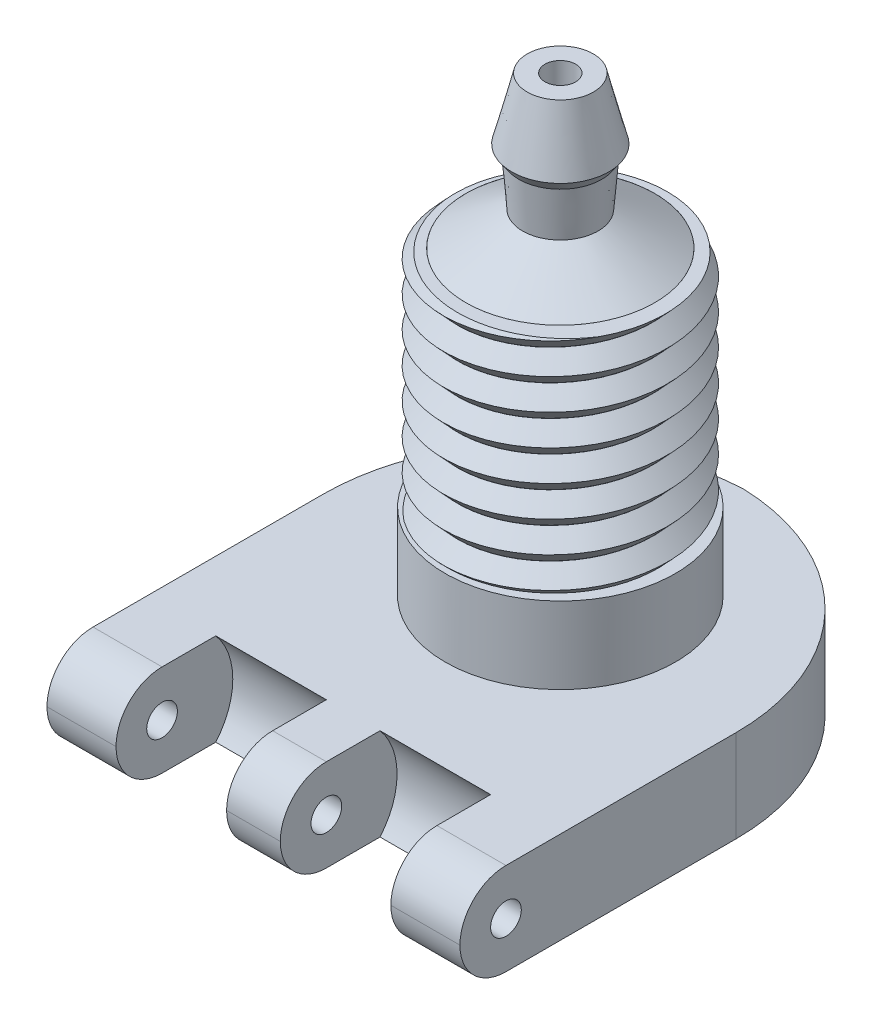
from build123d import *

# Parameters (mm, degrees)
BOSS_EXTRUDE1_DEPTH      = 20
BOSS_EXTRUDE1_DEPTH_BACK = 12
SKETCH2_W                = 26.91519165
SKETCH2_H                = 6
FILLET1_R                = 14
SKETCH4_W                = 7.207595825
SKETCH4_H                = 6.5
CUT_EXTRUDE1_DEPTH       = 13
SKETCH5_R                = 1
CUT_EXTRUDE2_DEPTH       = 30
CUT_EXTRUDE3_DEPTH       = 7.207595825
CUT_EXTRUDE4_START       = 7.207595825
CUT_EXTRUDE4_DEPTH       = 7.207595825
FILLET2_R                = 3
SKETCH8_R                = 1
CUT_EXTRUDE5_DEPTH       = 38
SWEEP3_PITCH             = 2.01214
WRAP1_START              = -0.5
WRAP1_DEPTH              = 0.5


with BuildPart() as part:
    # Sketch1 → Revolve2 (revolve)
    with BuildSketch(Plane.XY):
        Polygon((13.457595825, 35.5), (11.302582741, 35.503288463), (10.291628838, 31.503910259), (10.750306129, 30.852541164), (10.998346612, 27.8087122), (7.098749399, 25.500055313), (7.098749399, 11), (5.953514099, 11), (5.953514099, 6), (13.457595825, 6), align=None)
    revolve(axis=Axis((13.457595825, 35.5, 0), (0, -1, 0)))

    # Sketch2 → Boss-Extrude1 (add, two sides: drawn at the far end of the back side and taken through both)
    with BuildSketch(Plane.XY.offset(-BOSS_EXTRUDE1_DEPTH_BACK)):
        with Locations((13.457595825, 3)):
            Rectangle(SKETCH2_W, SKETCH2_H)
    extrude(amount=BOSS_EXTRUDE1_DEPTH + BOSS_EXTRUDE1_DEPTH_BACK)

    # Fillet1
    # the kernel refuses this fillet: 14 mm, written as the material it takes off along each edge
    with BuildSketch(Plane(origin=(0, 41, -12), x_dir=(0, 0, 1), z_dir=(0, -1, 0)), Plane(origin=(26.91519165, -35, -12), x_dir=(0, 0, 1), z_dir=(0, 1, 0))) as fillet1_piece_1:
        with BuildLine():
            CenterArc((FILLET1_R, -FILLET1_R), FILLET1_R, 90, 90)
            Line((0, -FILLET1_R), (0, 0))
            Line((0, 0), (FILLET1_R, 0))
        make_face()
    extrude(amount=76, mode=Mode.SUBTRACT)

    # Sketch4 → Cut-Extrude1 (cut)
    with BuildSketch(Plane.XZ):
        with Locations((18.811393738, 16.75)):
            Rectangle(SKETCH4_W, SKETCH4_H)
        with Locations((8.103797912, 16.75)):
            Rectangle(SKETCH4_W, SKETCH4_H)
    extrude(amount=-CUT_EXTRUDE1_DEPTH, mode=Mode.SUBTRACT)

    # Sketch5 → Cut-Extrude2 (cut)
    with BuildSketch(Plane.ZY):
        with Locations((17, 3)):
            Circle(SKETCH5_R)
    extrude(amount=-CUT_EXTRUDE2_DEPTH, mode=Mode.SUBTRACT)

    # Sketch6 → Cut-Extrude3 (cut)
    with BuildSketch(Plane.ZY.offset(-11.707595825)):
        with BuildLine():
            Line((13.5, 6), (13.5, 0))
            ThreePointArc((13.5, 0), (12.390227771, 3), (13.5, 6))
        make_face()
    extrude(amount=CUT_EXTRUDE3_DEPTH, mode=Mode.SUBTRACT)

    # Sketch7 → Cut-Extrude4 (cut)
    with BuildSketch(Plane(origin=(15.207595825, 0, 0), x_dir=(0, 0, -1), z_dir=(1, 0, 0)).offset(CUT_EXTRUDE4_START)):
        with BuildLine():
            Line((-13.5, 0), (-13.5, 6))
            ThreePointArc((-13.5, 6), (-12.390227771, 3), (-13.5, 0))
        make_face()
    extrude(amount=-CUT_EXTRUDE4_DEPTH, mode=Mode.SUBTRACT)

    # Fillet2
    fillet2_edges = [part.edges().sort_by_distance(p)[0] for p in [
        (24.66519165, 0, 20),
        (24.66519165, 6, 20),
        (13.457595825, 6, 20),
        (2.25, 0, 20),
        (2.25, 6, 20),
        (13.457595825, 0, 20),
    ]]
    fillet(fillet2_edges, radius=FILLET2_R - 0.0001)  # a hair under: the kernel refuses the full size

    # Sketch8 → Cut-Extrude5 (cut)
    with BuildSketch(Plane.XZ):
        with Locations(Location((13.457595825, 0, 0), (0, 0, 270))):
            Circle(SKETCH8_R)
    extrude(amount=-CUT_EXTRUDE5_DEPTH, mode=Mode.SUBTRACT)

    # Sweep3: arcs per turn and ends read off the stored shape
    # Sweep3: the profile of Sketch9 screwed along a right-hand helix through 8 turns, 10 arcs to a turn; built about Z, then put on its axis
    sweep3_z = Axis((0, 0, 0), (0, 0, 1))
    sweep3_corners = [(6.358846426, 0, 0.701156501), (7.292926426, 0, -0.300558499), (6.358846426, 0, -1.302273499), (6.161908614, 0, -1.302273499), (6.161908614, 0, 0.701156501)]
    with BuildLine(mode=Mode.PRIVATE) as sweep3_profile:
        Line(sweep3_corners[0], sweep3_corners[1])
        Line(sweep3_corners[1], sweep3_corners[2])
        Line(sweep3_corners[2], sweep3_corners[3])
        Line(sweep3_corners[3], sweep3_corners[4])
        Line(sweep3_corners[4], sweep3_corners[0])
    sweep3_cap = Face(sweep3_profile.wire())
    sweep3_turn_angles = [0, 18, 36, 54, 72, 90, 108, 126, 144, 162, 180, 198, 216, 234, 252, 270, 288, 306, 324, 342, 360]
    sweep3_turn_weights = [1, 0.9510565162951535, 1, 0.9510565162951535, 1, 0.9510565162951535, 1, 0.9510565162951535, 1, 0.9510565162951535, 1, 0.9510565162951535, 1, 0.9510565162951535, 1, 0.9510565162951535, 1, 0.9510565162951535, 1, 0.9510565162951535, 1]
    sweep3_turn_rails = [Edge.make_bspline([Vector(p[0], p[1], 0).rotate(sweep3_z, sweep3_turn_angles[k]) / sweep3_turn_weights[k] + Vector(0, 0, p[2] + SWEEP3_PITCH * sweep3_turn_angles[k] / 360) for k in range(21)], [0, 0, 0, 1, 1, 2, 2, 3, 3, 4, 4, 5, 5, 6, 6, 7, 7, 8, 8, 9, 9, 10, 10, 10], 2, sweep3_turn_weights) for p in sweep3_corners]
    sweep3_turn_sides = [Face.make_surface_from_curves(sweep3_turn_rails[p[0]], sweep3_turn_rails[p[1]]) for p in [(0, 1), (1, 2), (2, 3), (3, 4), (4, 0)]]
    sweep3 = Plane(origin=(13.457595825, 11, 0), x_dir=(-1, 0, 0), z_dir=(0, 1, 0)) * Solid(Shell([*[p.moved(Location((0, 0, SWEEP3_PITCH * i))) for i in range(8) for p in sweep3_turn_sides], sweep3_cap, sweep3_cap.rotate(sweep3_z, 2880).moved(Location((0, 0, SWEEP3_PITCH * 2880 / 360)))]))
    add(sweep3)

    # Sketch17 → Cut-Revolve1 (revolve, cut)
    with BuildSketch(Plane.XY, mode=Mode.PRIVATE) as cut_revolve1_sk:
        Polygon((10.998346612, 27.8087122), (7.299797899, 25.61908094), (3.175246287, 25.61908094), (3.175246287, 28.971235863), align=None)
    revolve(cut_revolve1_sk.sketch.rotate(Axis((13.457595825, 30.852541164, 0), (0, 1, 0)), 307.237240979), axis=Axis((13.457595825, 30.852541164, 0), (0, 1, 0)), mode=Mode.SUBTRACT)

    # Wrap1: read off the stored shape, not the designer's step
    # Wrap1 outline → Wrap1 (cut)
    # profile 1 of 3: a face of its own
    with BuildSketch(Plane(origin=(0, 0, 0), x_dir=(-1, 0, 0), z_dir=(0, -1, 0)).offset(WRAP1_START)):
        with BuildLine():
            add(Edge.make_bspline(
                [(-9.153677489, -6.033817377), (-9.091342639, -6.034096401), (-8.971085647, -6.034634697), (-8.797665171, -6.041162251), (-8.63767629, -6.052860025), (-8.491155762, -6.067316623), (-8.358163833, -6.087584212), (-8.238533957, -6.110819416), (-8.132241307, -6.139126656), (-8.038087277, -6.172726958), (-7.953587076, -6.212340402), (-7.873622632, -6.254531546), (-7.80000115, -6.30488519), (-7.729006732, -6.35797443), (-7.664698251, -6.418870861), (-7.603063759, -6.483521738), (-7.546713645, -6.554491061), (-7.495386803, -6.630919765), (-7.448825449, -6.711395775), (-7.408146335, -6.796062959), (-7.375149715, -6.885055292), (-7.347469655, -6.977797097), (-7.32523676, -7.07428433), (-7.310437838, -7.175110397), (-7.300385666, -7.279571293), (-7.2994987, -7.350667444), (-7.299050086, -7.386626872)],
                knots=[0, 0, 0, 0, 0.070781161, 0.136551696, 0.197012482, 0.252922694, 0.303686532, 0.349719151, 0.391240471, 0.428478555, 0.463056565, 0.497150358, 0.531002334, 0.564226377, 0.59770067, 0.631421421, 0.665597347, 0.700451436, 0.735880684, 0.771092108, 0.806974845, 0.843534403, 0.880940196, 0.919294384, 0.95918024, 1, 1, 1, 1], degree=3))
            Line((-9.153677489, -6.033817377), (-10.107703932, -6.033817377))
            Line((-10.107703932, -6.033817377), (-10.107703932, -10.796317377))
            Line((-10.107703932, -10.796317377), (-9.252896239, -10.796317377))
            Line((-9.252896239, -10.796317377), (-9.252896239, -8.720355839))
            add(Edge.make_bspline(
                [(-8.282651348, -8.647849829), (-8.307065584, -8.653924131), (-8.359954682, -8.667083024), (-8.447471611, -8.680442603), (-8.548325684, -8.692725915), (-8.662843027, -8.703281934), (-8.791089663, -8.710457568), (-8.932941414, -8.716061418), (-9.088462566, -8.720135996), (-9.196605825, -8.72028058), (-9.252896239, -8.720355839)],
                knots=[0, 0, 0, 0, 0.077372749, 0.167614291, 0.272108317, 0.390015992, 0.52136331, 0.667272254, 0.826809521, 1, 1, 1, 1], degree=3))
            add(Edge.make_bspline(
                [(-7.299050086, -7.386626872), (-7.299699175, -7.426407932), (-7.300974715, -7.504582602), (-7.313479116, -7.619177078), (-7.334840584, -7.728432535), (-7.362758906, -7.833270345), (-7.40168902, -7.931965693), (-7.446164847, -8.026873481), (-7.500884222, -8.115332785), (-7.563409856, -8.198450124), (-7.631694981, -8.276901283), (-7.707360683, -8.348421131), (-7.788964742, -8.413497218), (-7.876034782, -8.472811546), (-7.968897688, -8.526244464), (-8.067486455, -8.574296316), (-8.172474305, -8.615430254), (-8.245584685, -8.63694297), (-8.282651348, -8.647849829)],
                knots=[0, 0, 0, 0, 0.068875425, 0.135348675, 0.199289315, 0.26155008, 0.322915384, 0.382771997, 0.442843572, 0.502652029, 0.562748843, 0.622739582, 0.682687332, 0.743329247, 0.805012514, 0.86806712, 0.933110571, 1, 1, 1, 1], degree=3))
        make_face()
        with BuildLine():
            add(Edge.make_bspline(
                [(-8.950469857, -7.865548146), (-8.895438602, -7.865199205), (-8.794180276, -7.864557149), (-8.655897159, -7.855272641), (-8.544770187, -7.841093321), (-8.456977815, -7.820756897), (-8.387657422, -7.789893681), (-8.327872924, -7.754190752), (-8.276594233, -7.709045378), (-8.232194434, -7.657459064), (-8.196698132, -7.598183803), (-8.172083296, -7.532184779), (-8.156093983, -7.460848701), (-8.154617221, -7.411203512), (-8.153857778, -7.385672846)],
                knots=[0, 0, 0, 0, 0.155159592, 0.285495954, 0.390502806, 0.470975045, 0.538445527, 0.60365534, 0.666587169, 0.73019895, 0.794944675, 0.860228437, 0.928120706, 1, 1, 1, 1], degree=3))
            Line((-8.950469857, -7.865548146), (-9.252896239, -7.865548146))
            Line((-9.252896239, -7.865548146), (-9.252896239, -6.888625069))
            Line((-9.252896239, -6.888625069), (-8.983860783, -6.888625069))
            add(Edge.make_bspline(
                [(-8.378053992, -6.983073687), (-8.393172607, -6.97542777), (-8.425181814, -6.959239796), (-8.479696597, -6.940420093), (-8.542605824, -6.9245436), (-8.614334203, -6.911366264), (-8.69459559, -6.901139283), (-8.783375663, -6.893318201), (-8.880805072, -6.890173039), (-8.948561397, -6.889155291), (-8.983860783, -6.888625069)],
                knots=[0, 0, 0, 0, 0.08210116, 0.173824981, 0.278953094, 0.396639095, 0.527315592, 0.671298143, 0.82875438, 1, 1, 1, 1], degree=3))
            add(Edge.make_bspline(
                [(-8.153857778, -7.385672846), (-8.154609409, -7.363367035), (-8.156067755, -7.3200884), (-8.166781159, -7.257626595), (-8.183855244, -7.199399307), (-8.208594937, -7.146014643), (-8.240577501, -7.097563313), (-8.279570719, -7.054064403), (-8.325074231, -7.014586347), (-8.360205603, -6.993690009), (-8.378053992, -6.983073687)],
                knots=[0, 0, 0, 0, 0.137787685, 0.267341238, 0.390444331, 0.511777883, 0.629508981, 0.747829066, 0.87188531, 1, 1, 1, 1], degree=3))
        make_face(mode=Mode.SUBTRACT)
    # profile 2 of 3: a face of its own
    with BuildSketch(Plane(origin=(0, 0, 0), x_dir=(-1, 0, 0), z_dir=(0, -1, 0)).offset(WRAP1_START)):
        with BuildLine():
            add(Edge.make_bspline(
                [(-13.670992694, -6.033817377), (-13.587020683, -6.03440437), (-13.424701837, -6.035539034), (-13.189533942, -6.048323972), (-12.970857725, -6.067986299), (-12.768532223, -6.095035393), (-12.582972236, -6.130828751), (-12.414417041, -6.175724503), (-12.262300925, -6.22754918), (-12.124955967, -6.288531429), (-11.999573231, -6.359630675), (-11.880518321, -6.438829527), (-11.768024999, -6.529029271), (-11.6605146, -6.628489773), (-11.559374567, -6.739030632), (-11.462920557, -6.858820893), (-11.373514202, -6.989597678), (-11.288452941, -7.128225373), (-11.211526349, -7.275291469), (-11.144428101, -7.429544169), (-11.088219492, -7.589990801), (-11.042547086, -7.756802359), (-11.006140907, -7.929425078), (-10.980668238, -8.108207296), (-10.96492078, -8.29298349), (-10.963323332, -8.418215389), (-10.962511624, -8.481849228)],
                knots=[0, 0, 0, 0, 0.060148162, 0.116267077, 0.168653955, 0.217398969, 0.262433523, 0.303932701, 0.342259967, 0.377441339, 0.411406099, 0.445398351, 0.479766387, 0.514584482, 0.550213651, 0.587000908, 0.624662987, 0.663615456, 0.703456428, 0.743450162, 0.784013386, 0.825132536, 0.867264663, 0.910306473, 0.954424205, 1, 1, 1, 1], degree=3))
            Line((-13.670992694, -6.033817377), (-14.748088547, -6.033817377))
            Line((-14.748088547, -6.033817377), (-14.748088547, -10.796317377))
            Line((-14.748088547, -10.796317377), (-13.654774244, -10.796317377))
            add(Edge.make_bspline(
                [(-10.962511624, -8.481849228), (-10.964637114, -8.571640717), (-10.968821265, -8.748400518), (-11.00406622, -9.007793489), (-11.061069244, -9.256447524), (-11.141220674, -9.492417554), (-11.240586992, -9.713602231), (-11.359291185, -9.916101055), (-11.495592774, -10.098827117), (-11.647903837, -10.260870589), (-11.812819622, -10.400149149), (-11.984200379, -10.519431044), (-12.163715669, -10.613494771), (-12.321893726, -10.673145241), (-12.459053836, -10.710242672), (-12.579478928, -10.732167611), (-12.716269546, -10.752274102), (-12.870701143, -10.767811966), (-13.04209626, -10.781667923), (-13.231138082, -10.78919671), (-13.437214544, -10.795452015), (-13.580354132, -10.796021365), (-13.654774244, -10.796317377)],
                knots=[0, 0, 0, 0, 0.065772947, 0.129477895, 0.191430088, 0.252445668, 0.311786958, 0.36881755, 0.424091518, 0.478492106, 0.531393744, 0.58200397, 0.631201271, 0.679503008, 0.705561374, 0.735221723, 0.769132486, 0.80685832, 0.848929771, 0.895116661, 0.945469804, 1, 1, 1, 1], degree=3))
        make_face()
        with BuildLine():
            add(Edge.make_bspline(
                [(-13.44679648, -9.941509685), (-13.393671696, -9.941412338), (-13.291495052, -9.941225108), (-13.143975106, -9.932307186), (-13.007556561, -9.923356051), (-12.882614945, -9.906366498), (-12.768240972, -9.887441331), (-12.666005841, -9.861104369), (-12.573802041, -9.833439623), (-12.492755824, -9.798218971), (-12.418524093, -9.758575784), (-12.349793989, -9.712129195), (-12.283450196, -9.660552009), (-12.220733064, -9.602327268), (-12.161405224, -9.538225977), (-12.105817698, -9.46791785), (-12.053228538, -9.391617401), (-12.00498761, -9.308921209), (-11.960904791, -9.220702564), (-11.921798391, -9.127815994), (-11.889373415, -9.029487952), (-11.86242376, -8.926638908), (-11.843165175, -8.818373444), (-11.82723237, -8.705493468), (-11.819018545, -8.587551757), (-11.817891248, -8.507300276), (-11.817319316, -8.466584805)],
                knots=[0, 0, 0, 0, 0.062614648, 0.120428813, 0.174199486, 0.223724664, 0.26902845, 0.310765001, 0.348115258, 0.382378114, 0.414753161, 0.447195432, 0.480044579, 0.513738641, 0.547962504, 0.582917814, 0.619315101, 0.657123545, 0.695686576, 0.735513716, 0.7758232, 0.817652262, 0.860742584, 0.905386927, 0.951998197, 1, 1, 1, 1], degree=3))
            Line((-13.44679648, -9.941509685), (-13.893280855, -9.941509685))
            Line((-13.893280855, -9.941509685), (-13.893280855, -6.888625069))
            Line((-13.893280855, -6.888625069), (-13.567003812, -6.888625069))
            add(Edge.make_bspline(
                [(-12.266665771, -7.270235646), (-12.302088149, -7.239232492), (-12.374434346, -7.17591206), (-12.501450494, -7.100037989), (-12.641415711, -7.033375181), (-12.797531981, -6.980519008), (-12.96829051, -6.938718094), (-13.154708339, -6.909889025), (-13.35578716, -6.891363771), (-13.495089883, -6.889557528), (-13.567003812, -6.888625069)],
                knots=[0, 0, 0, 0, 0.101663476, 0.207636138, 0.318744567, 0.436679942, 0.563506646, 0.698681208, 0.844446556, 1, 1, 1, 1], degree=3))
            add(Edge.make_bspline(
                [(-11.817319316, -8.466584805), (-11.818458411, -8.404192195), (-11.820679557, -8.28253144), (-11.842099811, -8.105329894), (-11.876967899, -7.938468093), (-11.926721301, -7.782565306), (-11.989437006, -7.637183362), (-12.06794033, -7.503553957), (-12.158852792, -7.379432299), (-12.230743887, -7.306618552), (-12.266665771, -7.270235646)],
                knots=[0, 0, 0, 0, 0.142276686, 0.277428514, 0.406477152, 0.530595072, 0.650142922, 0.766850697, 0.883502093, 1, 1, 1, 1], degree=3))
        make_face(mode=Mode.SUBTRACT)
    # profile 3 of 3: a face of its own
    with BuildSketch(Plane(origin=(0, 0, 0), x_dir=(-1, 0, 0), z_dir=(0, -1, 0)).offset(WRAP1_START)):
        with BuildLine():
            add(Edge.make_bspline(
                [(-18.53366547, -7.193913531), (-18.527630203, -7.151184744), (-18.515798461, -7.067417787), (-18.487486685, -6.946144102), (-18.453622745, -6.831107711), (-18.411345347, -6.722672912), (-18.361760837, -6.620646547), (-18.305373434, -6.524678511), (-18.241573569, -6.435180717), (-18.192670297, -6.38126689), (-18.168273343, -6.354370262)],
                knots=[0, 0, 0, 0, 0.138934236, 0.272371367, 0.40070198, 0.524915333, 0.646775011, 0.765706493, 0.883115226, 1, 1, 1, 1], degree=3))
            Line((-18.53366547, -7.193913531), (-17.678857778, -7.193913531))
            add(Edge.make_bspline(
                [(-17.121706336, -6.766509685), (-17.152678512, -6.768034198), (-17.214136795, -6.7710593), (-17.304007201, -6.793637855), (-17.389354145, -6.831646043), (-17.468410333, -6.884057094), (-17.540034573, -6.947000545), (-17.598817408, -7.021543997), (-17.647710184, -7.103221424), (-17.668434544, -7.163564316), (-17.678857778, -7.193913531)],
                knots=[0, 0, 0, 0, 0.123522589, 0.245106649, 0.36726561, 0.494690546, 0.622323873, 0.746002836, 0.872253148, 1, 1, 1, 1], degree=3))
            add(Edge.make_bspline(
                [(-16.640877009, -7.214902113), (-16.642533199, -7.183896003), (-16.645765731, -7.123378641), (-16.670871327, -7.036765547), (-16.714451798, -6.959557153), (-16.772885558, -6.891915927), (-16.844089125, -6.835416905), (-16.927552189, -6.794399579), (-17.021463594, -6.770300068), (-17.087535328, -6.76780176), (-17.121706336, -6.766509685)],
                knots=[0, 0, 0, 0, 0.126208081, 0.246331455, 0.363483818, 0.484754462, 0.608382757, 0.731214254, 0.860989275, 1, 1, 1, 1], degree=3))
            add(Edge.make_bspline(
                [(-17.556742393, -7.804490454), (-17.50007993, -7.799664897), (-17.394075681, -7.790637236), (-17.246936101, -7.769525737), (-17.123063541, -7.741306743), (-17.019480723, -7.707262054), (-16.933472188, -7.663539803), (-16.858335607, -7.61527237), (-16.793624429, -7.559216799), (-16.738934803, -7.497044662), (-16.695184804, -7.430277617), (-16.664221103, -7.359953421), (-16.643774293, -7.288247992), (-16.641836959, -7.23920364), (-16.640877009, -7.214902113)],
                knots=[0, 0, 0, 0, 0.141703761, 0.265099674, 0.370057991, 0.458023549, 0.535993518, 0.609847615, 0.680075159, 0.748587094, 0.815630364, 0.878070744, 0.939583928, 1, 1, 1, 1], degree=3))
            Line((-17.556742393, -7.804490454), (-17.556742393, -8.598240454))
            add(Edge.make_bspline(
                [(-16.396646239, -9.368139793), (-16.397551757, -9.341997468), (-16.399354434, -9.28995409), (-16.414082494, -9.214007722), (-16.437341215, -9.140953438), (-16.469650419, -9.071114755), (-16.512795759, -9.004749085), (-16.56370678, -8.940524932), (-16.626394428, -8.881785048), (-16.695171172, -8.823722453), (-16.774925177, -8.773109382), (-16.86177231, -8.726400955), (-16.957995049, -8.689235466), (-17.061244511, -8.656039801), (-17.173473755, -8.631794203), (-17.29398588, -8.614189535), (-17.422586482, -8.601085589), (-17.511232548, -8.599205612), (-17.556742393, -8.598240454)],
                knots=[0, 0, 0, 0, 0.05061342, 0.100759723, 0.149274813, 0.198888438, 0.249306497, 0.302322686, 0.357220648, 0.415437322, 0.476442931, 0.539828648, 0.606183849, 0.675941201, 0.749782408, 0.828287688, 0.911844924, 1, 1, 1, 1], degree=3))
            add(Edge.make_bspline(
                [(-17.146511023, -10.063625069), (-17.120086322, -10.06317193), (-17.068326244, -10.06228433), (-16.992298397, -10.05244648), (-16.919871169, -10.036243533), (-16.850909658, -10.014224329), (-16.784974853, -9.986621879), (-16.723326503, -9.951030172), (-16.664708061, -9.909649732), (-16.609756764, -9.863127132), (-16.558980633, -9.812434152), (-16.516731905, -9.756300289), (-16.478119626, -9.699258251), (-16.449561706, -9.637576147), (-16.424538815, -9.574573134), (-16.409223528, -9.507962399), (-16.397659386, -9.439141256), (-16.396987325, -9.392043087), (-16.396646239, -9.368139793)],
                knots=[0, 0, 0, 0, 0.069402223, 0.135943428, 0.201020377, 0.264180635, 0.325954798, 0.388453791, 0.450818569, 0.51426562, 0.577492176, 0.638835299, 0.698633645, 0.758057149, 0.817032435, 0.876414798, 0.937277956, 1, 1, 1, 1], degree=3))
            add(Edge.make_bspline(
                [(-17.923088547, -9.330932762), (-17.91767172, -9.360885204), (-17.907121028, -9.419225441), (-17.886542552, -9.503689134), (-17.859725925, -9.58165434), (-17.828719233, -9.653814011), (-17.795227338, -9.721115578), (-17.75476112, -9.781073428), (-17.71028573, -9.835315664), (-17.646107418, -9.89979943), (-17.5543601, -9.966053809), (-17.430470827, -10.023632016), (-17.292655742, -10.057379919), (-17.196309253, -10.061497059), (-17.146511023, -10.063625069)],
                knots=[0, 0, 0, 0, 0.077346353, 0.150652305, 0.220677485, 0.286575187, 0.35018847, 0.411378839, 0.469946039, 0.528233786, 0.642194432, 0.755364323, 0.873556122, 1, 1, 1, 1], degree=3))
            Line((-17.923088547, -9.330932762), (-18.777896239, -9.330932762))
            add(Edge.make_bspline(
                [(-17.193258319, -10.918432762), (-17.248973319, -10.917217359), (-17.35791663, -10.914840799), (-17.517269022, -10.894270472), (-17.668718388, -10.861088864), (-17.812651227, -10.814316636), (-17.948510676, -10.75366105), (-18.077528761, -10.681433856), (-18.197130954, -10.593469158), (-18.308649859, -10.49373785), (-18.409611651, -10.381844984), (-18.499847717, -10.260382504), (-18.577368336, -10.128888538), (-18.642491421, -9.987924882), (-18.694707857, -9.837244245), (-18.735896029, -9.677153042), (-18.76466664, -9.507338506), (-18.77342879, -9.390502492), (-18.777896239, -9.330932762)],
                knots=[0, 0, 0, 0, 0.066659045, 0.130342942, 0.191936224, 0.251995802, 0.311121943, 0.3697548, 0.428602208, 0.488435845, 0.548524359, 0.60866107, 0.669235799, 0.730880799, 0.794196272, 0.859830406, 0.928533466, 1, 1, 1, 1], degree=3))
            add(Edge.make_bspline(
                [(-15.541838547, -9.376726031), (-15.543473307, -9.429569299), (-15.546696721, -9.533765461), (-15.567189676, -9.687235744), (-15.605343867, -9.833556024), (-15.655537818, -9.974409936), (-15.722491102, -10.107979108), (-15.80128386, -10.23732877), (-15.898135992, -10.357973111), (-16.005770506, -10.473101655), (-16.125304908, -10.577771372), (-16.254899647, -10.668515306), (-16.391705045, -10.746389747), (-16.536586631, -10.809610438), (-16.68949407, -10.8582976), (-16.850086544, -10.893490924), (-17.019038819, -10.915022783), (-17.134361965, -10.91727999), (-17.193258319, -10.918432762)],
                knots=[0, 0, 0, 0, 0.062821161, 0.123870535, 0.183554169, 0.242266291, 0.301264887, 0.360846687, 0.4219487, 0.484789191, 0.548013913, 0.610412876, 0.672536447, 0.73482884, 0.797947255, 0.862973491, 0.930019585, 1, 1, 1, 1], degree=3))
            add(Edge.make_bspline(
                [(-16.42335898, -8.158434264), (-16.389412177, -8.169579714), (-16.322708234, -8.191480023), (-16.227896598, -8.234612435), (-16.137741566, -8.281749011), (-16.053795575, -8.336509287), (-15.975223681, -8.396678999), (-15.902504868, -8.462772501), (-15.835204658, -8.534645678), (-15.774421698, -8.612693805), (-15.720474447, -8.695668653), (-15.672070451, -8.781653554), (-15.632231264, -8.871952484), (-15.598482513, -8.965534167), (-15.572788135, -9.063239668), (-15.554696997, -9.164690384), (-15.544239875, -9.269654902), (-15.542644986, -9.340768298), (-15.541838547, -9.376726031)],
                knots=[0, 0, 0, 0, 0.066221473, 0.130122224, 0.19292189, 0.254764174, 0.315756781, 0.376302843, 0.436814419, 0.498168159, 0.559516228, 0.620243021, 0.680969814, 0.742349065, 0.804583897, 0.868102398, 0.93330738, 1, 1, 1, 1], degree=3))
            add(Edge.make_bspline(
                [(-15.786069316, -7.160522606), (-15.788054578, -7.212205489), (-15.791962949, -7.313953196), (-15.824033958, -7.462868526), (-15.874233807, -7.605258156), (-15.946752373, -7.739129841), (-16.037419051, -7.864119259), (-16.148664027, -7.976047637), (-16.277318758, -8.07666986), (-16.373901577, -8.130744255), (-16.42335898, -8.158434264)],
                knots=[0, 0, 0, 0, 0.124100703, 0.24431613, 0.364465941, 0.485853993, 0.608914794, 0.734300919, 0.863942817, 1, 1, 1, 1], degree=3))
            add(Edge.make_bspline(
                [(-17.115982177, -5.911701993), (-17.069823531, -5.912791708), (-16.979084935, -5.914933868), (-16.845722031, -5.93212997), (-16.718571662, -5.962290017), (-16.596289812, -6.001723602), (-16.48067485, -6.055379585), (-16.369175039, -6.117662761), (-16.26490569, -6.194055664), (-16.167622832, -6.280371957), (-16.078249972, -6.373731478), (-16.000852684, -6.473525127), (-15.934312846, -6.577087188), (-15.879492821, -6.685278064), (-15.837343672, -6.798280828), (-15.808090912, -6.915442677), (-15.788944271, -7.036505086), (-15.787036765, -7.118789575), (-15.786069316, -7.160522606)],
                knots=[0, 0, 0, 0, 0.068213911, 0.134094803, 0.198285615, 0.261160186, 0.323634654, 0.38636675, 0.449642386, 0.514244902, 0.578413338, 0.640374686, 0.70061485, 0.760103977, 0.81929898, 0.878465984, 0.938360402, 1, 1, 1, 1], degree=3))
            add(Edge.make_bspline(
                [(-18.168273343, -6.354370262), (-18.133083969, -6.318882109), (-18.063729412, -6.24893869), (-17.947829814, -6.159348897), (-17.82634563, -6.081815023), (-17.696840443, -6.020345607), (-17.561329452, -5.970593236), (-17.418735025, -5.937174456), (-17.269639855, -5.9150008), (-17.167901158, -5.912816618), (-17.115982177, -5.911701993)],
                knots=[0, 0, 0, 0, 0.127406864, 0.251105539, 0.372907792, 0.494496302, 0.616171436, 0.740562898, 0.867604851, 1, 1, 1, 1], degree=3))
        make_face()
    extrude(amount=WRAP1_DEPTH, mode=Mode.SUBTRACT)


solid = part.part
